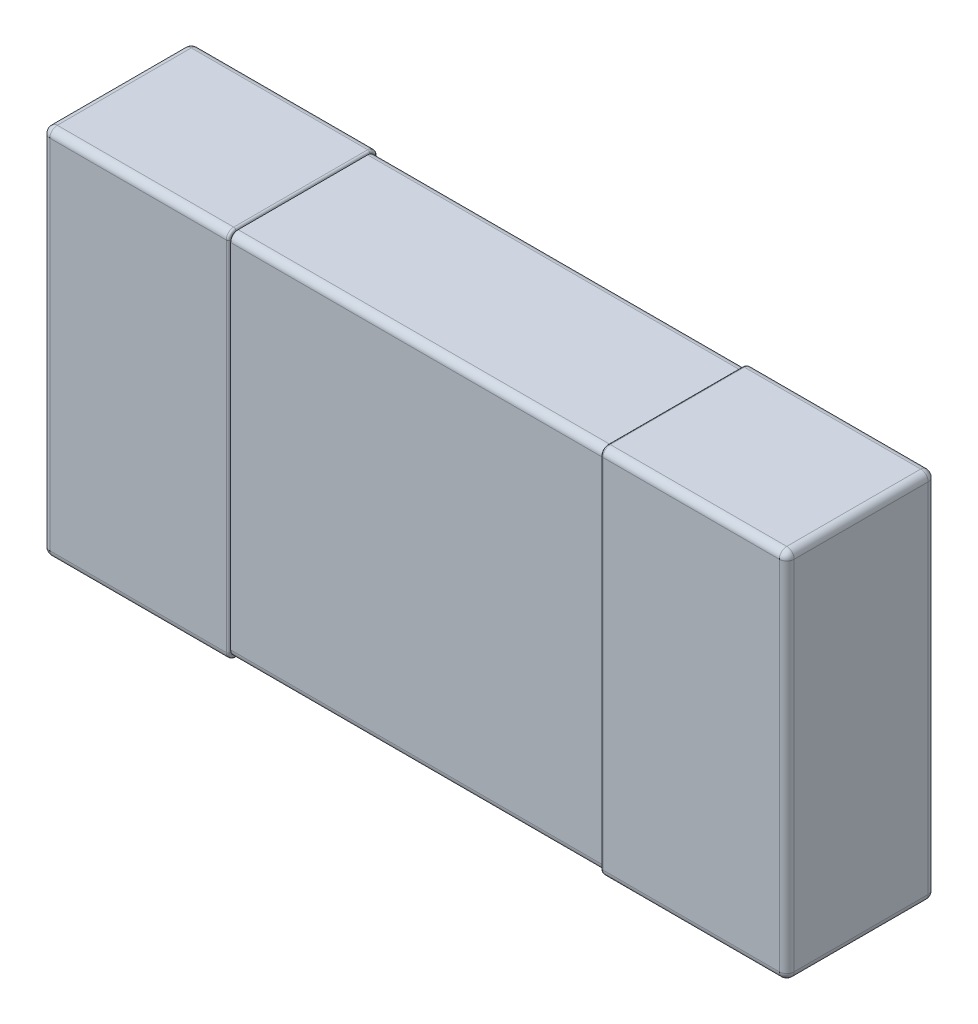
from build123d import *

# Parameters (mm, degrees)
SKETCH1_W                           = 1
SKETCH1_H                           = 0.5
ALL_BODY_DEPTH                      = 0.2
CUT_OUT_THE_BODY_FOR_PIN_DEPTH      = 0.25
CUT_OUT_THE_BODY_FOR_PIN_DEPTH_BACK = 0.25
SKETCH2_OUTSIDE_W                   = 2.428
SKETCH2_OUTSIDE_H                   = 2.728
SKETCH2_OUTSIDE_W_2                 = 0.194
SKETCH2_OUTSIDE_H_2                 = 0.494
BODY_FILLET_R                       = 0.01
PIN_FILLET_A_R                      = 0.01
PIN_FILLET_B_R                      = 0.003


with BuildPart() as part:
    # Sketch1 → All body (new body)
    with BuildSketch(Plane.XY):
        Rectangle(SKETCH1_W, SKETCH1_H)
    extrude(amount=ALL_BODY_DEPTH)

    # Sketch2 outside → Cut out the body for pin (cut, two sides: drawn at the far end of the back side and taken through both)
    with BuildSketch(Plane(origin=(0, 0, 0), x_dir=(0, 0, -1), z_dir=(1, 0, 0)).offset(-CUT_OUT_THE_BODY_FOR_PIN_DEPTH_BACK)):
        with Locations((-0.1, 0)):
            Rectangle(SKETCH2_OUTSIDE_W, SKETCH2_OUTSIDE_H)
        with Locations((-0.1, 0)):
            Rectangle(SKETCH2_OUTSIDE_W_2, SKETCH2_OUTSIDE_H_2, mode=Mode.SUBTRACT)
    extrude(amount=CUT_OUT_THE_BODY_FOR_PIN_DEPTH + CUT_OUT_THE_BODY_FOR_PIN_DEPTH_BACK, mode=Mode.SUBTRACT)

    # Body fillet
    body_fillet_edges = [part.edges().sort_by_distance(p)[0] for p in [
        (0, 0.247, 0.003),
        (0, 0.247, 0.197),
        (0, -0.247, 0.197),
        (0, -0.247, 0.003),
    ]]
    fillet(body_fillet_edges, radius=BODY_FILLET_R)

    # Pin fillet a
    pin_fillet_a_edges = [part.edges().sort_by_distance(p)[0] for p in [
        (0.5, 0, 0.2),
        (-0.375, 0.25, 0),
        (0.375, -0.25, 0),
        (0.375, -0.25, 0.2),
        (-0.375, 0.25, 0.2),
        (0.375, 0.25, 0.2),
        (-0.5, 0, 0.2),
        (0.375, 0.25, 0),
        (0.5, 0, 0),
        (-0.375, -0.25, 0),
        (-0.5, 0, 0),
        (-0.5, 0.25, 0.1),
        (0.5, 0.25, 0.1),
        (0.5, -0.25, 0.1),
        (-0.5, -0.25, 0.1),
        (-0.375, -0.25, 0.2),
    ]]
    fillet(pin_fillet_a_edges, radius=PIN_FILLET_A_R)

    # Pin fillet b
    pin_fillet_b_edges = [part.edges().sort_by_distance(p)[0] for p in [
        (0.25, -0.25, 0.1),
        (0.25, 0, 0.2),
        (0.25, 0.25, 0.1),
        (0.25, 0, 0),
        (-0.25, 0.25, 0.1),
        (-0.25, 0, 0.2),
        (-0.25, -0.25, 0.1),
        (-0.25, 0, 0),
        (0.25, 0.247071068, 0.002928932),
        (0.25, -0.247071068, 0.002928932),
        (0.25, -0.247071068, 0.197071068),
        (0.25, 0.247071068, 0.197071068),
        (-0.25, -0.247071068, 0.197071068),
        (-0.25, 0.247071068, 0.197071068),
        (-0.25, -0.247071068, 0.002928932),
        (-0.25, 0.247071068, 0.002928932),
    ]]
    fillet(pin_fillet_b_edges, radius=PIN_FILLET_B_R - 0.0001)  # a hair under: the kernel refuses the full size


solid = part.part
